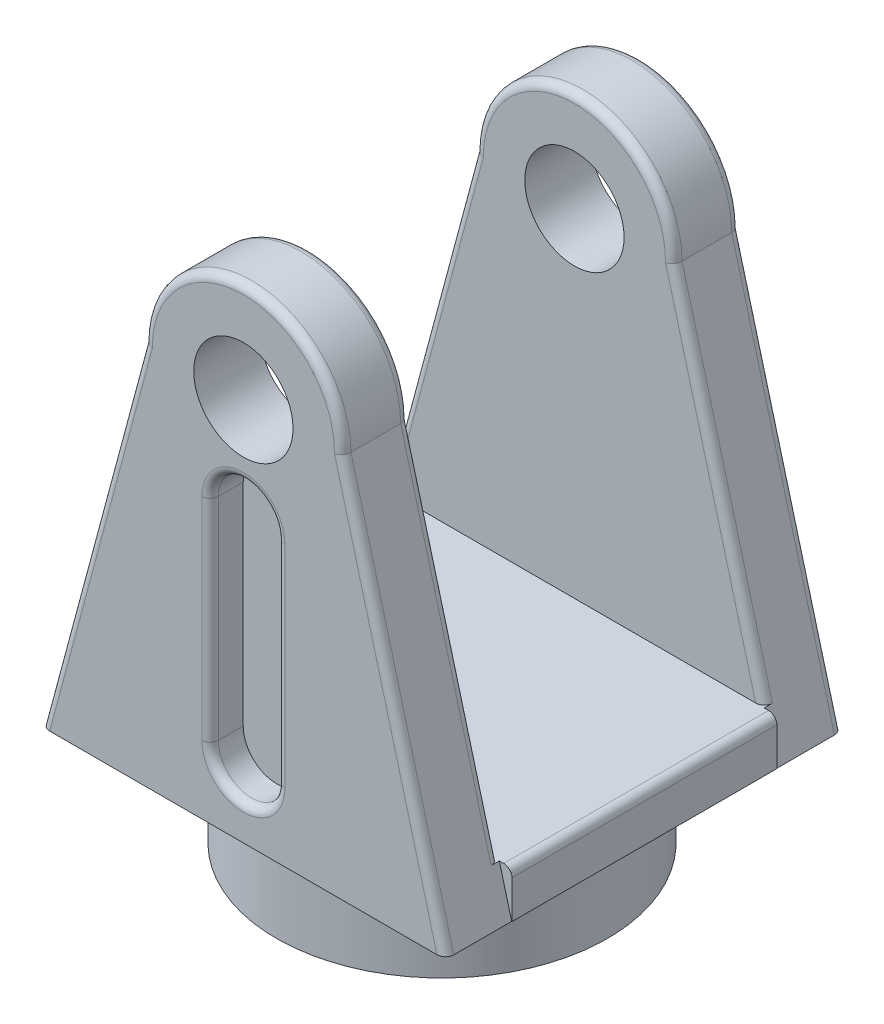
from build123d import *

# Parameters (mm, degrees)
SKETCH2_R           = 38.1
BOSS_EXTRUDE2_DEPTH = 50.8
SKETCH4_W           = 310.4151135
SKETCH4_H           = 35.471388383
BOSS_EXTRUDE4_DEPTH = 101.6
CUT_EXTRUDE1_DEPTH  = 25.4
FILLET1_R           = 6.35
FILLET2_R           = 6.35
FILLET3_R           = 6.35
FILLET4_R           = 6.35
FILLET5_R           = 6.35
SKETCH8_R           = 127
BOSS_EXTRUDE5_DEPTH = 76.2


with BuildPart() as part:
    # Sketch2 → Boss-Extrude2 (new body)
    with BuildSketch(Plane.XY):
        with BuildLine():
            Line((-76.2, 0), (-155.088044947, -294.414191853))
            Line((-155.088044947, -294.414191853), (155.088044947, -294.414191853))
            Line((155.088044947, -294.414191853), (76.2, 0))
            ThreePointArc((76.2, 0), (0, 76.2), (-76.2, 0))
        make_face()
        Circle(SKETCH2_R, mode=Mode.SUBTRACT)
    extrude(amount=BOSS_EXTRUDE2_DEPTH)

    # Sketch4 → Boss-Extrude4 (add)
    with BuildSketch(Plane.XY.offset(50.8)):
        with Locations((0.119511803, -276.678497662)):
            Rectangle(SKETCH4_W, SKETCH4_H)
    extrude(amount=BOSS_EXTRUDE4_DEPTH)

    # Sketch5 → Cut-Extrude1 (cut)
    with BuildSketch(Plane(origin=(0, 0, 0), x_dir=(-1, 0, 0), z_dir=(0, 0, -1))):
        with BuildLine():
            Line((25.506839575, -80.081330591), (25.506839575, -242.20722706))
            ThreePointArc((25.506839575, -242.20722706), (0, -267.714066635), (-25.506839575, -242.20722706))
            Line((-25.506839575, -242.20722706), (-25.506839575, -80.081330591))
            ThreePointArc((-25.506839575, -80.081330591), (0, -54.574491016), (25.506839575, -80.081330591))
        make_face()
    extrude(amount=-CUT_EXTRUDE1_DEPTH, mode=Mode.SUBTRACT)

    # Mirror5: part across plane


with BuildPart() as part_1:
    add(part.part)
    add(part.part.mirror(Plane(origin=(0, 0, 152.4), x_dir=(1, 0, 0), z_dir=(0, 0, -1))))

    # Fillet1
    fillet1_edges = [part_1.edges().sort_by_distance(p)[0] for p in [
        (115.644022474, -147.207095926, 304.8),
    ]]
    fillet(fillet1_edges, radius=FILLET1_R)

    # Fillet2
    fillet2_edges = [part_1.edges().sort_by_distance(p)[0] for p in [
        (-115.644022474, -147.207095926, 304.8),
    ]]
    fillet(fillet2_edges, radius=FILLET2_R)

    # Fillet3
    fillet3_edges = [part_1.edges().sort_by_distance(p)[0] for p in [
        (0, 76.2, 304.8),
    ]]
    fillet(fillet3_edges, radius=FILLET3_R)

    # Fillet4
    fillet4_edges = [part_1.edges().sort_by_distance(p)[0] for p in [
        (0, -54.574491016, 304.8),
        (25.506839575, -161.144278825, 304.8),
        (0, -267.714066635, 304.8),
        (-25.506839575, -161.144278825, 304.8),
    ]]
    fillet(fillet4_edges, radius=FILLET4_R)

    # Fillet5
    fillet5_edges = [part_1.edges().sort_by_distance(p)[0] for p in [
        (110.891757538, -129.471401735, 254),
    ]]
    fillet(fillet5_edges, radius=FILLET5_R)
    fillet5_2_edges = [part_1.edges().sort_by_distance(p)[0] for p in [
        (-110.891757538, -129.471401735, 254),
    ]]
    fillet(fillet5_2_edges, radius=FILLET5_R)
    fillet5_3_edges = [part_1.edges().sort_by_distance(p)[0] for p in [
        (-155.088044947, -258.94280347, 152.4),
    ]]
    fillet(fillet5_3_edges, radius=FILLET5_R)
    fillet5_4_edges = [part_1.edges().sort_by_distance(p)[0] for p in [
        (-115.644022474, -147.207095926, 0),
    ]]
    fillet(fillet5_4_edges, radius=FILLET5_R)
    fillet5_5_edges = [part_1.edges().sort_by_distance(p)[0] for p in [
        (-110.891757538, -129.471401735, 50.8),
    ]]
    fillet(fillet5_5_edges, radius=FILLET5_R)
    fillet5_6_edges = [part_1.edges().sort_by_distance(p)[0] for p in [
        (155.327068553, -258.94280347, 152.4),
    ]]
    fillet(fillet5_6_edges, radius=FILLET5_R)
    fillet5_7_edges = [part_1.edges().sort_by_distance(p)[0] for p in [
        (115.644022474, -147.207095926, 0),
    ]]
    fillet(fillet5_7_edges, radius=FILLET5_R)
    fillet5_8_edges = [part_1.edges().sort_by_distance(p)[0] for p in [
        (0, -54.574491016, 0),
        (-25.506839575, -161.144278825, 0),
        (0, -267.714066635, 0),
        (25.506839575, -161.144278825, 0),
    ]]
    fillet(fillet5_8_edges, radius=FILLET5_R)
    fillet5_9_edges = [part_1.edges().sort_by_distance(p)[0] for p in [
        (110.891757538, -129.471401735, 50.8),
    ]]
    fillet(fillet5_9_edges, radius=FILLET5_R)
    fillet5_10_edges = [part_1.edges().sort_by_distance(p)[0] for p in [
        (0, 76.2, 50.8),
    ]]
    fillet(fillet5_10_edges, radius=FILLET5_R - 0.0001)  # a hair under: the kernel refuses the full size
    fillet5_11_edges = [part_1.edges().sort_by_distance(p)[0] for p in [
        (0, 76.2, 254),
    ]]
    fillet(fillet5_11_edges, radius=FILLET5_R - 0.0001)  # a hair under: the kernel refuses the full size
    fillet5_12_edges = [part_1.edges().sort_by_distance(p)[0] for p in [
        (0, 76.2, 0),
    ]]
    fillet(fillet5_12_edges, radius=FILLET5_R - 0.0001)  # a hair under: the kernel refuses the full size

    # Sketch8 → Boss-Extrude5 (add)
    with BuildSketch(Plane(origin=(0, -294.414191853, 0), x_dir=(-1, 0, 0), z_dir=(0, -1, 0))):
        with Locations((0, -152.4)):
            Circle(SKETCH8_R)
    extrude(amount=BOSS_EXTRUDE5_DEPTH)


solid = part_1.part
